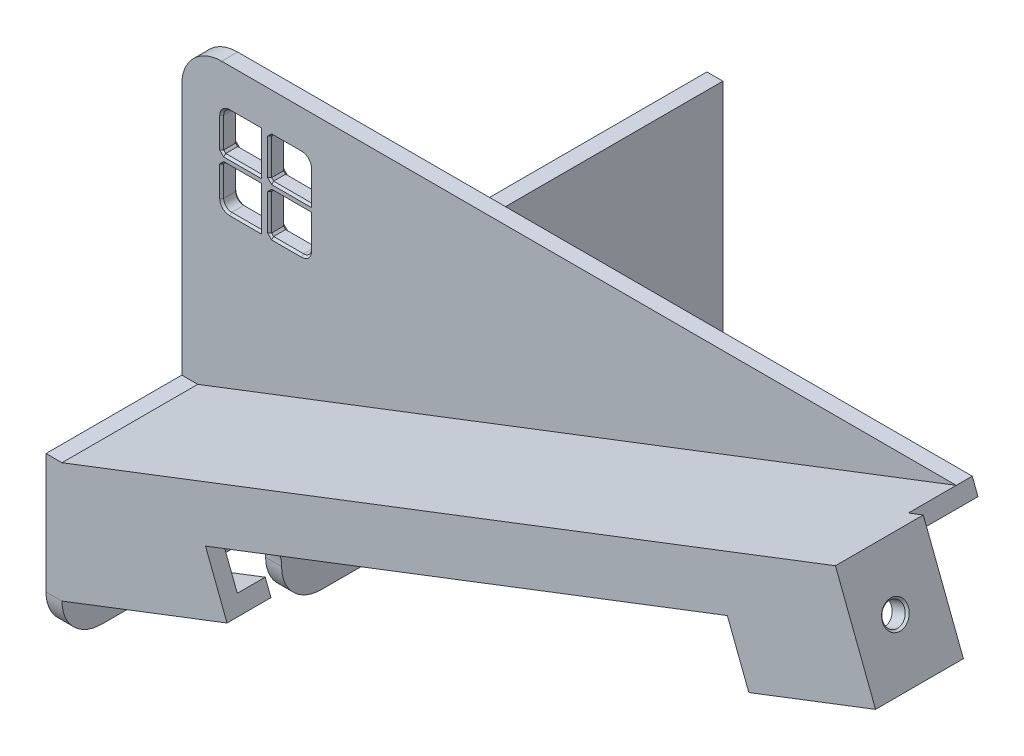
from build123d import *

# Parameters (mm, degrees)
SKETCH_1_W               = 165.5
SKETCH_1_H               = 60
EXTRUDE_1_DEPTH          = 4
EXTRUDE_2_DEPTH          = 4
SKETCH_3_W               = 214.285714285
SKETCH_3_H               = 25
EXTRUDE_5_DEPTH          = 4
SKETCH_4_R               = 2.75
CUT_EXTRUDE_1_DEPTH      = 4
SKETCH_5_W               = 55
SKETCH_5_H               = 20
CUT_EXTRUDE_2_DEPTH      = 4
FILLET_1_R               = 10
SKETCH_6_W               = 186.285714285
SKETCH_6_H               = 14
CUT_EXTRUDE_3_DEPTH      = 4
SKETCH_7_R               = 1.5
CUT_EXTRUDE_4_DEPTH      = 4
FILLET_2_R               = 3
CUT_EXTRUDE_5_DEPTH      = 4
FILLET_1_OF_MIRROR_1_R   = 10
FILLET_2_OF_MIRROR_1_R   = 3
CUT_EXTRUDE_6_DEPTH      = 292.712781796
CUT_EXTRUDE_6_DEPTH_BACK = 4
SKETCH_9_W               = 205.055051827
SKETCH_9_H               = 163.821453507
CUT_EXTRUDE_7_DEPTH      = 293.240221501
SKETCH_11_W              = 207.248718004
SKETCH_11_H              = 34
EXTRUDE_6_DEPTH          = 4
SKETCH_12_W              = 22
SKETCH_12_H              = 28
EXTRUDE_7_DEPTH          = 4
SKETCH_13_R              = 2.75
CUT_EXTRUDE_8_DEPTH      = 4
EXTRUDE_8_DEPTH          = 4
FILLET_3_R               = 10
SKETCH_15_W              = 10
SKETCH_15_H              = 10
CUT_EXTRUDE_9_DEPTH      = 4
FILLET_4_R               = 2
CHAMFER_1_SIZE           = 0.5
CHAMFER_2_SIZE           = 0.5


with BuildPart() as part:
    # 草图1 → 凸台-拉伸1 (new body)
    with BuildSketch(Plane(origin=(0, 0, 0), x_dir=(0, 0, -1), z_dir=(1, 0, 0))):
        with Locations((82.75, 30)):
            Rectangle(SKETCH_1_W, SKETCH_1_H)
    extrude_1 = extrude(amount=EXTRUDE_1_DEPTH)

    # 草图2 → 凸台-拉伸2 (add)
    with BuildSketch(Plane(origin=(0, 0, -165.5), x_dir=(-1, 0, 0), z_dir=(0, 0, -1))):
        Polygon((-4, 30), (-204, 106.930925816), (-193.94769236, 133.06425915), (-4, 60), align=None)
    extrude_2 = extrude(amount=-EXTRUDE_2_DEPTH)

    # 草图3 → 凸台-拉伸5 (add)
    with BuildSketch(Plane(origin=(-9.536752084, 24.793025648, 0), x_dir=(0.9333333333333335, 0.3590109871422999, 0), z_dir=(0.3590109871422999, -0.9333333333333335, 0))):
        with Locations((121.646520091, -153)):
            Rectangle(SKETCH_3_W, SKETCH_3_H)
    extrude_5 = extrude(amount=-EXTRUDE_5_DEPTH)

    # 草图4 → 切除-拉伸1 (cut)
    with BuildSketch(Plane(origin=(4, 0, 0), x_dir=(0, 0, -1), z_dir=(1, 0, 0))):
        with Locations((50, 50)):
            Circle(SKETCH_4_R)
        with Locations((50, 20)):
            Circle(SKETCH_4_R)
    cut_extrude_1 = extrude(amount=-CUT_EXTRUDE_1_DEPTH, mode=Mode.SUBTRACT)

    # 草图5 → 切除-拉伸2 (cut)
    with BuildSketch(Plane(origin=(4, 0, 0), x_dir=(0, 0, -1), z_dir=(1, 0, 0))):
        with Locations((138, 10)):
            Rectangle(SKETCH_5_W, SKETCH_5_H)
    cut_extrude_2 = extrude(amount=-CUT_EXTRUDE_2_DEPTH, mode=Mode.SUBTRACT)

    # 圆角1
    fillet_1_edges = [part.edges().sort_by_distance(p)[0] for p in [
        (2, 20, -165.5),
        (2, 20, -110.5),
        (2, 0, -110.5),
    ]]
    fillet(fillet_1_edges, radius=FILLET_1_R - 0.0001)  # a hair under: the kernel refuses the full size

    # 草图6 → 切除-拉伸3 (cut)
    with BuildSketch(Plane(origin=(-9.536752084, 24.793025648, 0), x_dir=(0.9333333333333335, 0.35901098714229984, 0), z_dir=(0.35901098714229984, -0.9333333333333335, 0))):
        with Locations((121.646520091, -147.5)):
            Rectangle(SKETCH_6_W, SKETCH_6_H)
    cut_extrude_3 = extrude(amount=-CUT_EXTRUDE_3_DEPTH, mode=Mode.SUBTRACT)

    # 草图7 → 切除-拉伸4 (cut)
    with BuildSketch(Plane(origin=(-9.536752084, 24.793025648, 0), x_dir=(0.9333333333333335, 0.35901098714229984, 0), z_dir=(0.35901098714229984, -0.9333333333333335, 0))):
        with Locations((221.789377233, -145.5)):
            Circle(SKETCH_7_R)
        with Locations((21.789377233, -145.5)):
            Circle(SKETCH_7_R)
    cut_extrude_4 = extrude(amount=-CUT_EXTRUDE_4_DEPTH, mode=Mode.SUBTRACT)

    # 圆角2
    fillet_2_edges = [part.edges().sort_by_distance(p)[0] for p in [
        (4, 32.142857143, -140.5),
        (203.281978026, 108.797592483, -140.5),
        (16.348644692, 36.892820487, -140.5),
        (190.215311359, 103.771438663, -140.5),
    ]]
    fillet(fillet_2_edges, radius=FILLET_2_R)

    # 草图8 → 切除-拉伸5 (cut)
    with BuildSketch(Plane.XY.offset(-161.5)):
        Polygon((45.333333333, 45.899058002), (39.948168526, 59.899058002), (170.614835193, 110.160596202), (176, 96.160596202), align=None)
    cut_extrude_5 = extrude(amount=-CUT_EXTRUDE_5_DEPTH, mode=Mode.SUBTRACT)

    # 镜向1: 凸台-拉伸1, 凸台-拉伸2, 凸台-拉伸5, 切除-拉伸1, 切除-拉伸2, 切除-拉伸3, 切除-拉伸4, 切除-拉伸5 across plane
    add(extrude_1.mirror(Plane.XY))
    add(extrude_2.mirror(Plane.XY))
    add(extrude_5.mirror(Plane.XY))
    add(cut_extrude_1.mirror(Plane.XY), mode=Mode.SUBTRACT)
    add(cut_extrude_2.mirror(Plane.XY), mode=Mode.SUBTRACT)
    add(cut_extrude_3.mirror(Plane.XY), mode=Mode.SUBTRACT)
    add(cut_extrude_4.mirror(Plane.XY), mode=Mode.SUBTRACT)
    add(cut_extrude_5.mirror(Plane.XY), mode=Mode.SUBTRACT)

    # 圆角1 of 镜向1
    fillet_1_of_mirror_1_edges = [part.edges().sort_by_distance(p)[0] for p in [
        (2, 20, 165.5),
        (2, 20, 110.5),
        (2, 0, 110.5),
    ]]
    fillet(fillet_1_of_mirror_1_edges, radius=FILLET_1_OF_MIRROR_1_R - 0.0001)  # a hair under: the kernel refuses the full size

    # 圆角2 of 镜向1
    fillet_2_of_mirror_1_edges = [part.edges().sort_by_distance(p)[0] for p in [
        (4, 32.142857143, 140.5),
        (203.281978026, 108.797592483, 140.5),
        (16.348644692, 36.892820487, 140.5),
        (190.215311359, 103.771438663, 140.5),
    ]]
    fillet(fillet_2_of_mirror_1_edges, radius=FILLET_2_OF_MIRROR_1_R)

    # 草图9 → 切除-拉伸6 (cut, two sides: drawn at the far end of the back side and taken through both)
    with BuildSketch(Plane(origin=(4, 0, 0), x_dir=(0, 0, -1), z_dir=(1, 0, 0)).offset(-CUT_EXTRUDE_6_DEPTH_BACK)):
        with Locations((102.527525913, 81.910726754)):
            Rectangle(SKETCH_9_W, SKETCH_9_H)
    extrude(amount=CUT_EXTRUDE_6_DEPTH + CUT_EXTRUDE_6_DEPTH_BACK, mode=Mode.SUBTRACT)

    # 草图10 → 切除-拉伸7 (cut, through all)
    with BuildSketch(Plane.XY.offset(161.5)):
        Polygon((174.563956051, 99.893929535), (43.897289385, 49.632391335), (45.333333333, 45.899058002), (176, 96.160596202), align=None)
    extrude(amount=-CUT_EXTRUDE_7_DEPTH, mode=Mode.SUBTRACT)

    # 草图11 → 凸台-拉伸6 (add)
    with BuildSketch(Plane(origin=(-19.589059724, 50.926358981, 0), x_dir=(0.9333333333333335, 0.3590109871422999, 0), z_dir=(-0.3590109871422999, 0.9333333333333335, 0))):
        with Locations((125.165018231, -148.5)):
            Rectangle(SKETCH_11_W, SKETCH_11_H)
    extrude(amount=-EXTRUDE_6_DEPTH)

    # 草图12 → 凸台-拉伸7 (add)
    with BuildSketch(Plane(origin=(213.536752084, 82.137900168, 0), x_dir=(0, 0, -1), z_dir=(0.9333333333333338, 0.35901098714229945, 0))):
        with Locations((-154.5, 40.563956051)):
            Rectangle(SKETCH_12_W, SKETCH_12_H)
    extrude(amount=EXTRUDE_7_DEPTH)

    # 草图13 → 切除-拉伸8 (cut)
    with BuildSketch(Plane(origin=(217.270085418, 83.573944117, 0), x_dir=(0, 0, -1), z_dir=(0.9333333333333338, 0.35901098714229945, 0))):
        with Locations(Location((-155.5, 40.563956051, 0), (0, 0, 90))):
            Circle(SKETCH_13_R)
    extrude(amount=-CUT_EXTRUDE_8_DEPTH, mode=Mode.SUBTRACT)

    # 草图14 → 凸台-拉伸8 (add)
    with BuildSketch(Plane(origin=(0, 0, 131.5), x_dir=(-1, 0, 0), z_dir=(0, 0, -1))):
        Polygon((-4, 55.714285714), (-4, 60), (0, 60), (0, 133.06425915), (-193.94769236, 133.06425915), (-195.383736309, 129.330925816), align=None)
    extrude(amount=EXTRUDE_8_DEPTH)

    # 圆角3
    fillet_3_edges = [part.edges().sort_by_distance(p)[0] for p in [
        (0, 133.06425915, 129.5),
    ]]
    fillet(fillet_3_edges, radius=FILLET_3_R)

    # 草图15 → 切除-拉伸9 (cut)
    with BuildSketch(Plane.XY.offset(131.5)):
        with Locations((15, 118.06425915)):
            Rectangle(SKETCH_15_W, SKETCH_15_H)
        with Locations((27, 118.06425915)):
            Rectangle(SKETCH_15_W, SKETCH_15_H)
        with Locations((15, 106.06425915)):
            Rectangle(SKETCH_15_W, SKETCH_15_H)
        with Locations((27, 106.06425915)):
            Rectangle(SKETCH_15_W, SKETCH_15_H)
    extrude(amount=-CUT_EXTRUDE_9_DEPTH, mode=Mode.SUBTRACT)

    # 圆角4
    fillet_4_edges = [part.edges().sort_by_distance(p)[0] for p in [
        (32, 123.06425915, 129.5),
        (10, 101.06425915, 129.5),
        (32, 101.06425915, 129.5),
        (10, 123.06425915, 129.5),
    ]]
    fillet(fillet_4_edges, radius=FILLET_4_R)

    # 倒角1
    chamfer_1_edges = [part.edges().sort_by_distance(p)[0] for p in [
        (22, 118.06425915, 127.5),
        (22, 113.06425915, 129.5),
        (22, 123.06425915, 129.5),
        (32, 117.06425915, 127.5),
        (27, 113.06425915, 127.5),
        (22, 118.06425915, 131.5),
        (27, 113.06425915, 131.5),
        (32, 117.06425915, 131.5),
        (10, 107.06425915, 127.5),
        (15, 111.06425915, 127.5),
        (10, 111.06425915, 129.5),
        (10, 107.06425915, 131.5),
        (15, 111.06425915, 131.5),
        (22, 106.06425915, 127.5),
        (22, 101.06425915, 129.5),
        (27, 111.06425915, 127.5),
        (22, 111.06425915, 129.5),
        (26, 101.06425915, 127.5),
        (22, 106.06425915, 131.5),
        (26, 101.06425915, 131.5),
        (27, 111.06425915, 131.5),
        (10, 113.06425915, 129.5),
        (16, 123.06425915, 127.5),
        (15, 113.06425915, 127.5),
        (15, 113.06425915, 131.5),
        (16, 123.06425915, 131.5),
        (26, 123.06425915, 131.5),
        (26, 123.06425915, 127.5),
        (10, 117.06425915, 131.5),
        (10, 117.06425915, 127.5),
        (16, 101.06425915, 131.5),
        (16, 101.06425915, 127.5),
        (32, 107.06425915, 131.5),
        (32, 107.06425915, 127.5),
        (31.414213562, 122.478472712, 131.5),
        (31.414213562, 122.478472712, 127.5),
        (10.585786438, 122.478472712, 131.5),
        (10.585786438, 122.478472712, 127.5),
        (10.585786438, 101.650045587, 131.5),
        (10.585786438, 101.650045587, 127.5),
        (31.414213562, 101.650045587, 131.5),
        (31.414213562, 101.650045587, 127.5),
    ]]
    chamfer(chamfer_1_edges, length=CHAMFER_1_SIZE)

    # 倒角2
    chamfer_2_edges = [part.edges().sort_by_distance(p)[0] for p in [
        (203.694459728, 118.866969765, 155.5),
    ]]
    chamfer(chamfer_2_edges, length=CHAMFER_2_SIZE)


solid = part.part
